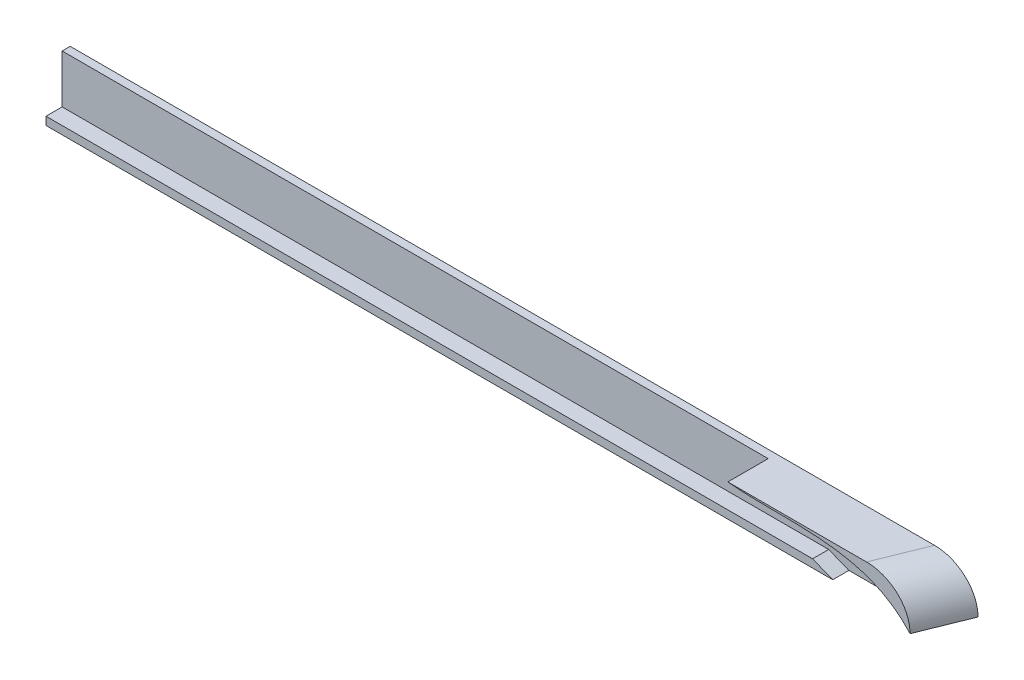
from build123d import *

# Parameters (mm, degrees)
SKETCH1_W           = 215
SKETCH1_H           = 14
BOSS_EXTRUDE1_DEPTH = 2
SKETCH2_W           = 215
SKETCH2_H           = 2
BOSS_EXTRUDE2_DEPTH = 4
SKETCH3_W           = 10
SKETCH3_H           = 10
BOSS_EXTRUDE3_DEPTH = 2
CUT_EXTRUDE1_DEPTH  = 4
BOSS_EXTRUDE4_START = -175
SKETCH8_W           = 10
SKETCH8_H           = 10
BOSS_EXTRUDE4_DEPTH = 50
CUT_EXTRUDE5_DEPTH  = 50
FILLET2_R           = 10
CUT_EXTRUDE6_DEPTH  = 10


with BuildPart() as part:
    # Sketch1 → Boss-Extrude1 (new body)
    with BuildSketch(Plane.XY):
        with Locations((-78.55, 1.825)):
            Rectangle(SKETCH1_W, SKETCH1_H)
    extrude(amount=BOSS_EXTRUDE1_DEPTH)

    # Sketch2 → Boss-Extrude2 (add)
    with BuildSketch(Plane.XY.offset(2)):
        with Locations((-78.55, -4.175)):
            Rectangle(SKETCH2_W, SKETCH2_H)
    extrude(amount=BOSS_EXTRUDE2_DEPTH)

    # Sketch3 → Boss-Extrude3 (add)
    with BuildSketch(Plane(origin=(0, 0, 0), x_dir=(-1, 0, 0), z_dir=(0, 0, -1))):
        with Locations((-33.95, 3.825)):
            Rectangle(SKETCH3_W, SKETCH3_H)
    extrude(amount=-BOSS_EXTRUDE3_DEPTH)

    # Sketch4 → Cut-Extrude1 (cut)
    with BuildSketch(Plane.XY.offset(6)):
        Polygon((28.95, -5.175), (8.95, -5.175), (3.95, -3.175), (28.95, -3.175), align=None)
    extrude(amount=-CUT_EXTRUDE1_DEPTH, mode=Mode.SUBTRACT)

    # Sketch8 → Boss-Extrude4 (add)
    with BuildSketch(Plane.ZY.offset(186.05).offset(BOSS_EXTRUDE4_START)):
        with Locations((7, 3.825)):
            Rectangle(SKETCH8_W, SKETCH8_H)
    extrude(amount=-BOSS_EXTRUDE4_DEPTH)

    # Sketch12 → Cut-Extrude5 (cut)
    with BuildSketch(Plane.XZ.offset(1.175)):
        Polygon((38.95, 0), (34.10168529, 12), (38.95, 12), align=None)
    extrude(amount=-CUT_EXTRUDE5_DEPTH, mode=Mode.SUBTRACT)

    # Fillet2
    fillet2_edges = [part.edges().sort_by_distance(p)[0] for p in [
        (36.525842645, 8.825, 6),
    ]]
    fillet(fillet2_edges, radius=FILLET2_R - 0.0001)  # a hair under: the kernel refuses the full size

    # Sketch13 → Cut-Extrude6 (cut)
    with BuildSketch(Plane.XY.offset(12)):
        with BuildLine():
            Line((-11.05, 8.825), (-11.05, -1.175))
            Line((-11.05, -1.175), (34.10168529, -1.175))
            add(Edge.make_bspline(
                [(-11.05, 8.825), (3.606248202, 7.334330419), (22.993995007, 11.334895317), (34.10168529, -1.175)],
                knots=[0, 0, 0, 0, 1, 1, 1, 1], degree=3))
        make_face()
    extrude(amount=-CUT_EXTRUDE6_DEPTH, mode=Mode.SUBTRACT)


solid = part.part
